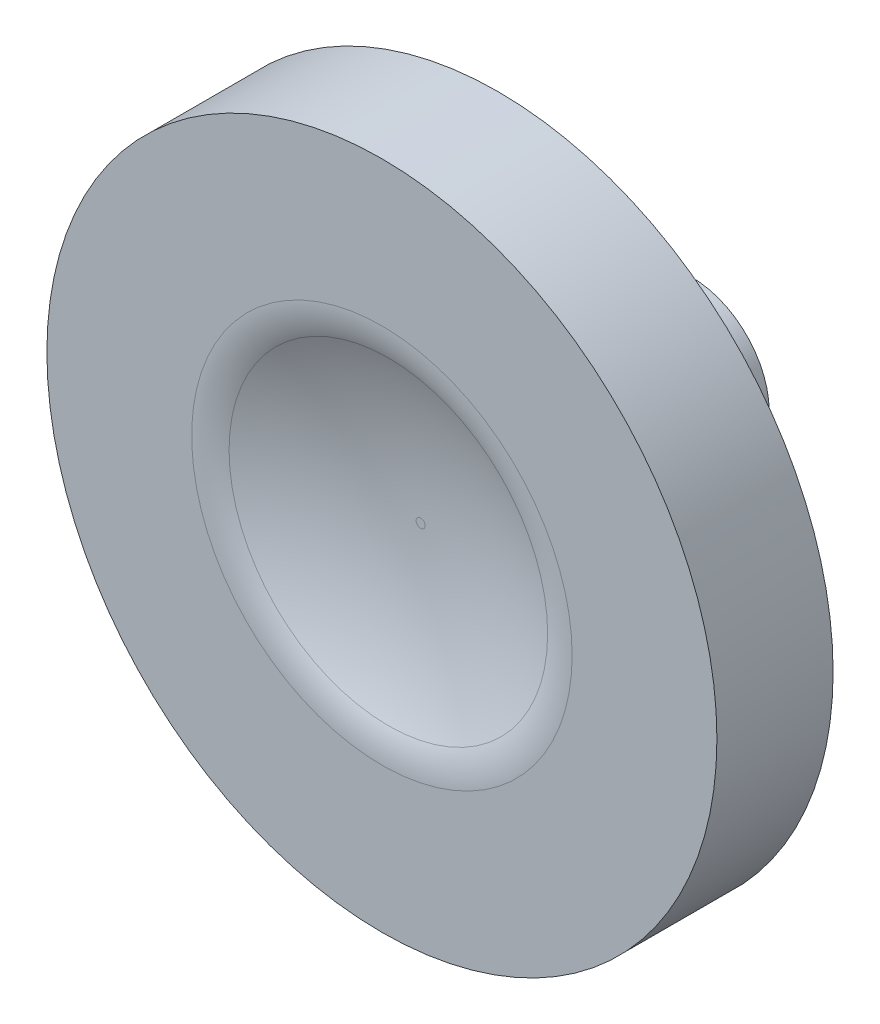
from build123d import *

# Parameters (mm, degrees)
SKETCH1_R           = 4.0386
BOSS_EXTRUDE1_DEPTH = 2.54
SKETCH1_4_R         = 10.9855
SKETCH1_4_R_2       = 4.0386
BOSS_EXTRUDE2_DEPTH = 3.81
FILLET1_R           = 2.54
FILLET2_R           = 12.7
SKETCH1_6_R         = 4.0386
BOSS_EXTRUDE3_DEPTH = 2.54
SKETCH3_R           = 2.54
BOSS_EXTRUDE4_DEPTH = 3.81


with BuildPart() as part:
    # Sketch1 → Boss-Extrude1 (new body)
    with BuildSketch(Plane.XY):
        Circle(SKETCH1_R)
    extrude(amount=BOSS_EXTRUDE1_DEPTH)

    # Sketch1<4> → Boss-Extrude2 (add)
    with BuildSketch(Plane.XY):
        with Locations(Location((0, 0, 0), (0, 0, 180))):
            Circle(SKETCH1_4_R)
        with Locations(Location((0, 0, 0), (0, 0, 180))):
            Circle(SKETCH1_4_R_2, mode=Mode.SUBTRACT)
    extrude(amount=BOSS_EXTRUDE2_DEPTH)

    # Fillet1
    # the kernel refuses this fillet: 2.54 mm, written as the material it takes off along each edge
    with BuildSketch(Plane(origin=(0, 0, 3.81), x_dir=(-1, 0, 0), z_dir=(0, 1, 0))) as fillet1_piece_1:
        with BuildLine():
            CenterArc((6.238304526, -2.54), FILLET1_R, 90, 60)
            Line((4.0386, -1.27), (3.994605909, -1.2446))
            ThreePointArc((3.994605909, -1.2446), (3.9878, -0.635), (3.9878, 0))
            Line((3.9878, 0), (4.0386, 0.0508))
            Line((4.0386, 0.0508), (6.238304526, 0.0508))
            Line((6.238304526, 0.0508), (6.238304526, 0))
        make_face()
    revolve(axis=Axis((0, 0, 3.81), (0, 0, 1)), mode=Mode.SUBTRACT)

    # Fillet2
    fillet2_edges = [part.edges().sort_by_distance(p)[0] for p in [
        (4.0386, 0, 2.54),
    ]]
    fillet(fillet2_edges, radius=FILLET2_R)

    # Sketch1<6> → Boss-Extrude3 (add)
    with BuildSketch(Plane.XY):
        Circle(SKETCH1_6_R)
    extrude(amount=-BOSS_EXTRUDE3_DEPTH)

    # Sketch3 → Boss-Extrude4 (add)
    with BuildSketch(Plane(origin=(0, 0, -2.54), x_dir=(-1, 0, 0), z_dir=(0, 0, -1))):
        with Locations(Location((0, 0, 0), (0, 0, 180))):
            Circle(SKETCH3_R)
    extrude(amount=BOSS_EXTRUDE4_DEPTH)


solid = part.part
